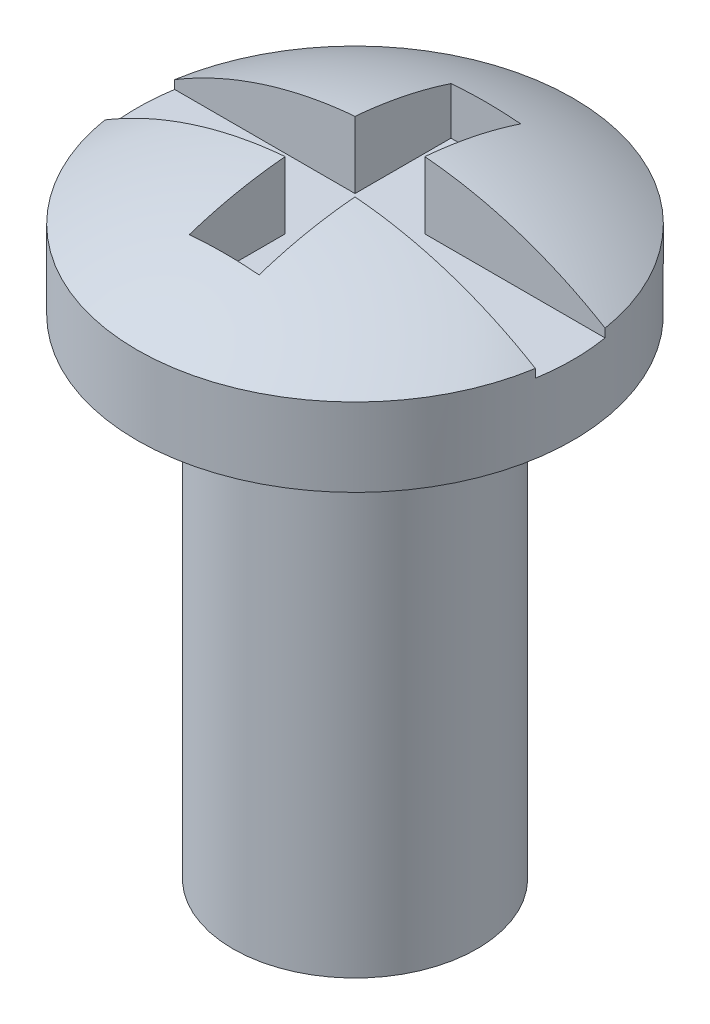
from build123d import *

# Parameters (mm, degrees)
SKETCH_1_R          = 1.75
EXTRUDE_1_DEPTH     = 7
SKETCH_2_R          = 3.125
EXTRUDE_2_DEPTH     = 2
SKETCH_3_W          = 7.004697232
SKETCH_3_H          = 1
CUT_EXTRUDE_1_DEPTH = 1
SKETCH_4_W          = 1
SKETCH_4_H          = 3.75
CUT_EXTRUDE_2_DEPTH = 1


with BuildPart() as part:
    # 草图1 → 拉伸1 (new body)
    with BuildSketch(Plane(origin=(0, 0, 0), x_dir=(1, 0, 0), z_dir=(0, 1, 0))):
        Circle(SKETCH_1_R)
    extrude(amount=EXTRUDE_1_DEPTH)

    # 草图2 → 拉伸2 (add)
    with BuildSketch(Plane(origin=(0, 7, 0), x_dir=(-1, 0, 0), z_dir=(0, 1, 0))):
        Circle(SKETCH_2_R)
    extrude(amount=EXTRUDE_2_DEPTH)

    # 草图3 → 切除-拉伸1 (cut)
    with BuildSketch(Plane(origin=(0, 9, 0), x_dir=(-1, 0, 0), z_dir=(0, 1, 0))):
        Rectangle(SKETCH_3_W, SKETCH_3_H)
    extrude(amount=-CUT_EXTRUDE_1_DEPTH, mode=Mode.SUBTRACT)

    # 草图4 → 切除-拉伸2 (cut)
    with BuildSketch(Plane(origin=(0, 9, 0), x_dir=(-1, 0, 0), z_dir=(0, 1, 0))):
        Rectangle(SKETCH_4_W, SKETCH_4_H)
    extrude(amount=-CUT_EXTRUDE_2_DEPTH, mode=Mode.SUBTRACT)

    # 草图5 → 切除-旋转16 (revolve, cut)
    with BuildSketch(Plane(origin=(0, 0, 0), x_dir=(0, 0, -1), z_dir=(1, 0, 0))):
        with BuildLine():
            Line((0, 10.999822694), (-4.5493707, 10.999822694))
            Line((-4.5493707, 10.999822694), (-4.5493707, 6.911933822))
            ThreePointArc((-4.5493707, 6.911933822), (-2.502838096, 8.453054325), (0, 9))
            Line((0, 9), (0, 10.999822694))
        make_face()
    revolve(axis=Axis((0, -2.105917543, 0), (0, 1, 0)), mode=Mode.SUBTRACT)


solid = part.part
